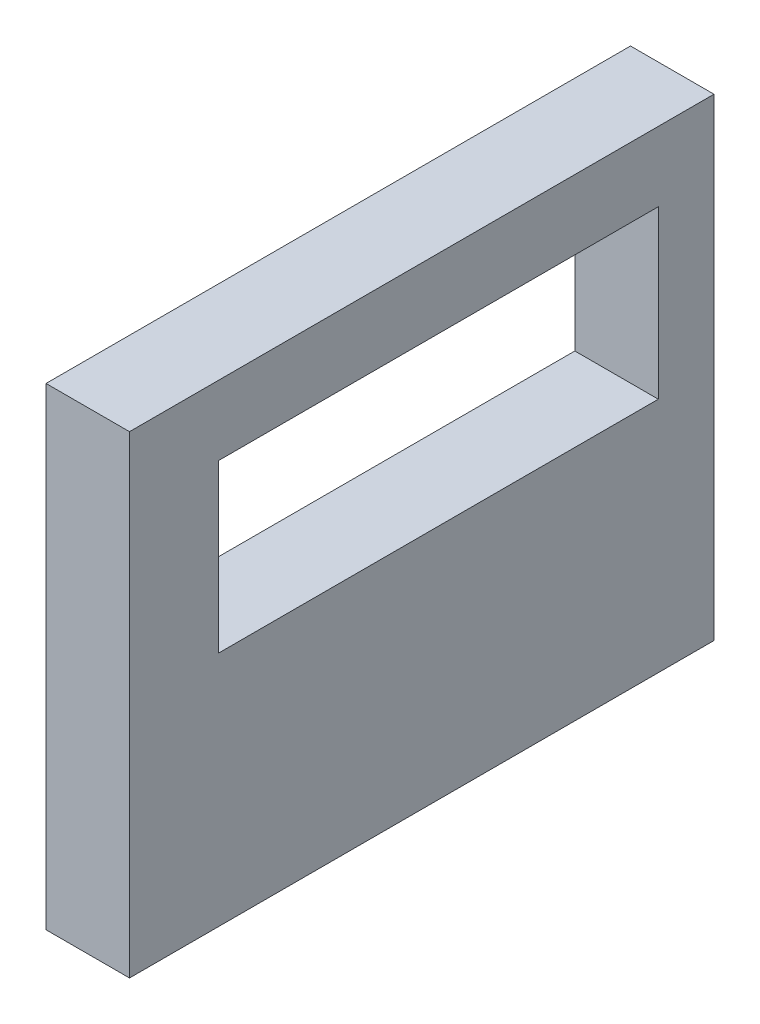
from build123d import *

# Parameters (mm, degrees)
SKETCH4_W           = 38.1
SKETCH4_H           = 241.3
BOSS_EXTRUDE1_DEPTH = 266.7
CUT_EXTRUDE3_DEPTH  = 296.189638199
SKETCH13_W          = 38.1
SKETCH13_H          = 266.7
CUT_EXTRUDE5_DEPTH  = 25.4


with BuildPart() as part:
    # Sketch4 → Boss-Extrude1 (new body)
    with BuildSketch(Plane.XY):
        Rectangle(SKETCH4_W, SKETCH4_H)
    extrude(amount=BOSS_EXTRUDE1_DEPTH)

    # Sketch11 → Cut-Extrude3 (cut, through all)
    with BuildSketch(Plane(origin=(19.05, 0, 0), x_dir=(0, 0, -1), z_dir=(1, 0, 0))):
        Polygon((-25.4, 12.825), (-25.4000001, 88.9), (-226.0000001, 88.9), (-226.0000001, 12.825), align=None)
    extrude(amount=-CUT_EXTRUDE3_DEPTH, mode=Mode.SUBTRACT)

    # Sketch13 → Cut-Extrude5 (cut)
    with BuildSketch(Plane.XZ.offset(120.65)):
        with Locations((0, 133.35)):
            Rectangle(SKETCH13_W, SKETCH13_H)
    extrude(amount=-CUT_EXTRUDE5_DEPTH, mode=Mode.SUBTRACT)


solid = part.part
